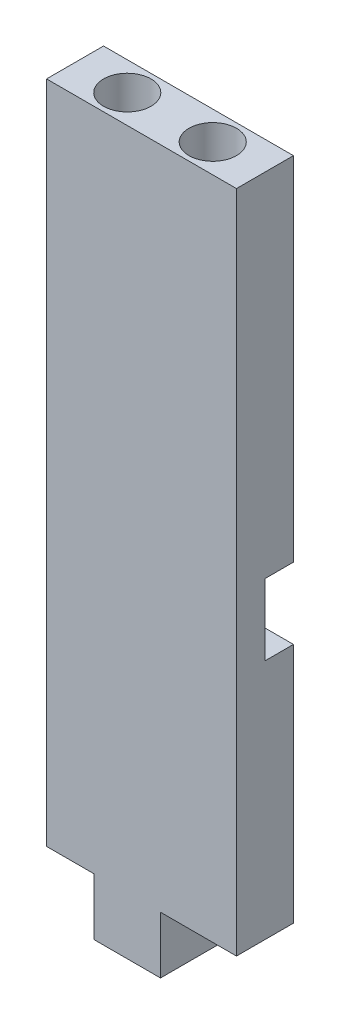
from build123d import *

# Parameters (mm, degrees)
ESQUISSE1_W                = 20
ESQUISSE1_H                = 70
BOSS_EXTRU_1_DEPTH         = 6
ESQUISSE2_W                = 8
ESQUISSE2_H                = 7.5
ESQUISSE2_W_2              = 7
ENL_V_MAT_EXTRU_1_DEPTH    = 3
ESQUISSE3_W                = 7
ESQUISSE3_H                = 6
BOSS_EXTRU_2_DEPTH         = 6
ESQUISSE4_R                = 2.5
ENL_V_MAT_EXTRU_2_DEPTH    = 10
R_P_TITION_LIN_AIRE1_COUNT = 2
R_P_TITION_LIN_AIRE1_PITCH = 9


with BuildPart() as part:
    # Esquisse1 → Boss.-Extru.1 (new body)
    with BuildSketch(Plane.XY):
        with Locations((10, 35)):
            Rectangle(ESQUISSE1_W, ESQUISSE1_H)
    extrude(amount=BOSS_EXTRU_1_DEPTH)

    # Esquisse2 → Enlèv. mat.-Extru.1 (cut)
    with BuildSketch(Plane(origin=(0, 0, 0), x_dir=(-1, 0, 0), z_dir=(0, 0, -1))):
        with Locations((-4, 29.174574215)):
            Rectangle(ESQUISSE2_W, ESQUISSE2_H)
        with Locations((-16.5, 29.174574215)):
            Rectangle(ESQUISSE2_W_2, ESQUISSE2_H)
    extrude(amount=-ENL_V_MAT_EXTRU_1_DEPTH, mode=Mode.SUBTRACT)

    # Esquisse3 → Boss.-Extru.2 (add)
    with BuildSketch(Plane.XZ):
        with Locations((8.5, 3)):
            Rectangle(ESQUISSE3_W, ESQUISSE3_H)
    extrude(amount=BOSS_EXTRU_2_DEPTH)

    # Esquisse4 → Enlèv. mat.-Extru.2 (cut)
    with BuildSketch(Plane(origin=(0, 70, 0), x_dir=(1, 0, 0), z_dir=(0, 1, 0))):
        with Locations((5.5, -3)):
            Circle(ESQUISSE4_R)
    enl_v_mat_extru_2 = extrude(amount=-ENL_V_MAT_EXTRU_2_DEPTH, mode=Mode.SUBTRACT)

    # Répétition linéaire1: Enlèv. mat.-Extru.2 ×2
    with Locations(*[(i * R_P_TITION_LIN_AIRE1_PITCH, 0, 0) for i in range(1, R_P_TITION_LIN_AIRE1_COUNT)]):
        add(enl_v_mat_extru_2, mode=Mode.SUBTRACT)


solid = part.part
